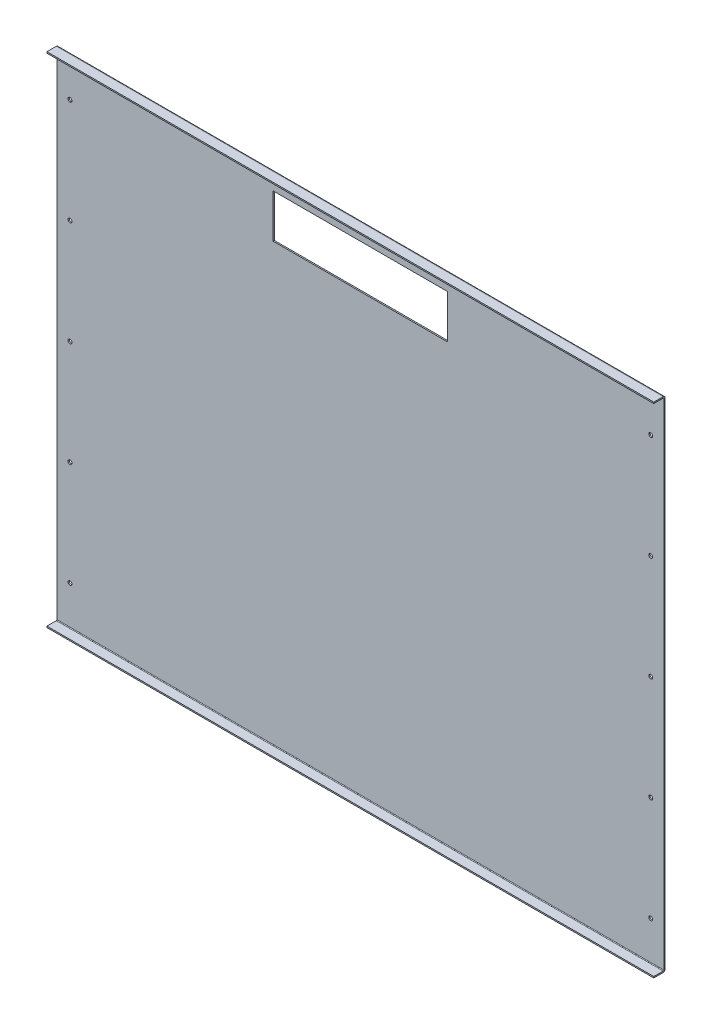
from build123d import *

# Parameters (mm, degrees)
SKETCH_1_W                         = 696
SKETCH_1_H                         = 572
SM_BASE_FLANGE_1_DEPTH             = 1.5
SM_EDGE_FLANGE_1_STRIP_W           = 7.4732
SM_EDGE_FLANGE_1_STRIP_H           = 1.5
SM_EDGE_FLANGE_1_STRIP_CUT_DEPTH   = 696
SM_EDGE_FLANGE_1_STRIP_2_W         = 7.4732
SM_EDGE_FLANGE_1_STRIP_2_H         = 1.5
SM_EDGE_FLANGE_1_STRIP_CUT_2_DEPTH = 696
SM_EDGE_FLANGE_1_DEPTH             = 696
SM_EDGE_FLANGE_1_BEND_DEPTH        = 696
SKETCH_8_R                         = 2.25
CUT_EXTRUDE_1_DEPTH                = 10
PATTERN_LINEAR_1_COUNT             = 3
PATTERN_LINEAR_1_PITCH             = 120
PATTERN_LINEAR_1_COL_COUNT         = 3
PATTERN_LINEAR_1_COL_PITCH         = 120
SKETCH_9_W                         = 200
SKETCH_9_H                         = 50
CUT_EXTRUDE_2_DEPTH                = 10


# Sheet-metal steps are written as plain solids
with BuildPart() as part:
    # Sketch 1 → Базовая кромка1 (new body)
    with BuildSketch(Plane.XY):
        Rectangle(SKETCH_1_W, SKETCH_1_H)
    extrude(amount=-SM_BASE_FLANGE_1_DEPTH)

    # Ребро-кромка1 strip (across the edge) → Ребро-кромка1 strip cut (cut)
    with BuildSketch(Plane(origin=(348, 286, 0), x_dir=(0, -1, 0), z_dir=(-1, 0, 0))):
        with Locations((-1.5, -0.75)):
            Rectangle(SM_EDGE_FLANGE_1_STRIP_W, SM_EDGE_FLANGE_1_STRIP_H)
    extrude(amount=SM_EDGE_FLANGE_1_STRIP_CUT_DEPTH, mode=Mode.SUBTRACT)

    # Ребро-кромка1 strip 2 (across the edge) → Ребро-кромка1 strip cut 2 (cut)
    with BuildSketch(Plane(origin=(-348, -286, 0), x_dir=(0, 1, 0), z_dir=(1, 0, 0))):
        with Locations((-1.5, -0.75)):
            Rectangle(SM_EDGE_FLANGE_1_STRIP_2_W, SM_EDGE_FLANGE_1_STRIP_2_H)
    extrude(amount=SM_EDGE_FLANGE_1_STRIP_CUT_2_DEPTH, mode=Mode.SUBTRACT)

    # Ребро-кромка1 section (across the edge) → Ребро-кромка1 (add)
    with BuildSketch(Plane(origin=(348, 286, 0), x_dir=(0, -1, 0), z_dir=(-1, 0, 0))):
        with BuildLine():
            Line((0, 0.7366), (0, 11.5))
            Line((0, 11.5), (1.5, 11.5))
            Line((1.5, 11.5), (1.5, 0.7366))
            ThreePointArc((1.5, 0.7366), (1.715745145, 0.215745145), (2.2366, 0))
            Line((2.2366, 0), (2.2366, -1.5))
            ThreePointArc((2.2366, -1.5), (0.655084973, -0.844915027), (0, 0.7366))
        make_face()
    extrude(amount=SM_EDGE_FLANGE_1_DEPTH)

    # Ребро-кромка1 section 2 (across the edge) → Ребро-кромка1 bend (add)
    with BuildSketch(Plane(origin=(-348, -286, 0), x_dir=(0, 1, 0), z_dir=(1, 0, 0))):
        with BuildLine():
            Line((0, 0.7366), (0, 11.5))
            Line((0, 11.5), (1.5, 11.5))
            Line((1.5, 11.5), (1.5, 0.7366))
            ThreePointArc((1.5, 0.7366), (1.715745145, 0.215745145), (2.2366, 0))
            Line((2.2366, 0), (2.2366, -1.5))
            ThreePointArc((2.2366, -1.5), (0.655084973, -0.844915027), (0, 0.7366))
        make_face()
    extrude(amount=SM_EDGE_FLANGE_1_BEND_DEPTH)

    # Эскиз8 → Вырез-Вытянуть1 (cut)
    with BuildSketch(Plane.XY):
        with Locations((333, 0)):
            Circle(SKETCH_8_R)
        with Locations(Location((-333, 0, 0), (0, 0, 180))):
            Circle(SKETCH_8_R)
    cut_extrude_1 = extrude(amount=-CUT_EXTRUDE_1_DEPTH, mode=Mode.SUBTRACT)

    # Линейный массив1: Вырез-Вытянуть1 ×3
    with Locations(*[(0, -i * PATTERN_LINEAR_1_PITCH, 0) for i in range(1, PATTERN_LINEAR_1_COUNT)]):
        add(cut_extrude_1, mode=Mode.SUBTRACT)

    # Линейный массив1 col: Вырез-Вытянуть1 ×3
    with Locations(*[(0, i * PATTERN_LINEAR_1_COL_PITCH, 0) for i in range(1, PATTERN_LINEAR_1_COL_COUNT)]):
        add(cut_extrude_1, mode=Mode.SUBTRACT)

    # Эскиз9 → Вырез-Вытянуть2 (cut)
    with BuildSketch(Plane.XY):
        with Locations((0, 241)):
            Rectangle(SKETCH_9_W, SKETCH_9_H)
    extrude(amount=-CUT_EXTRUDE_2_DEPTH, mode=Mode.SUBTRACT)


solid = part.part
